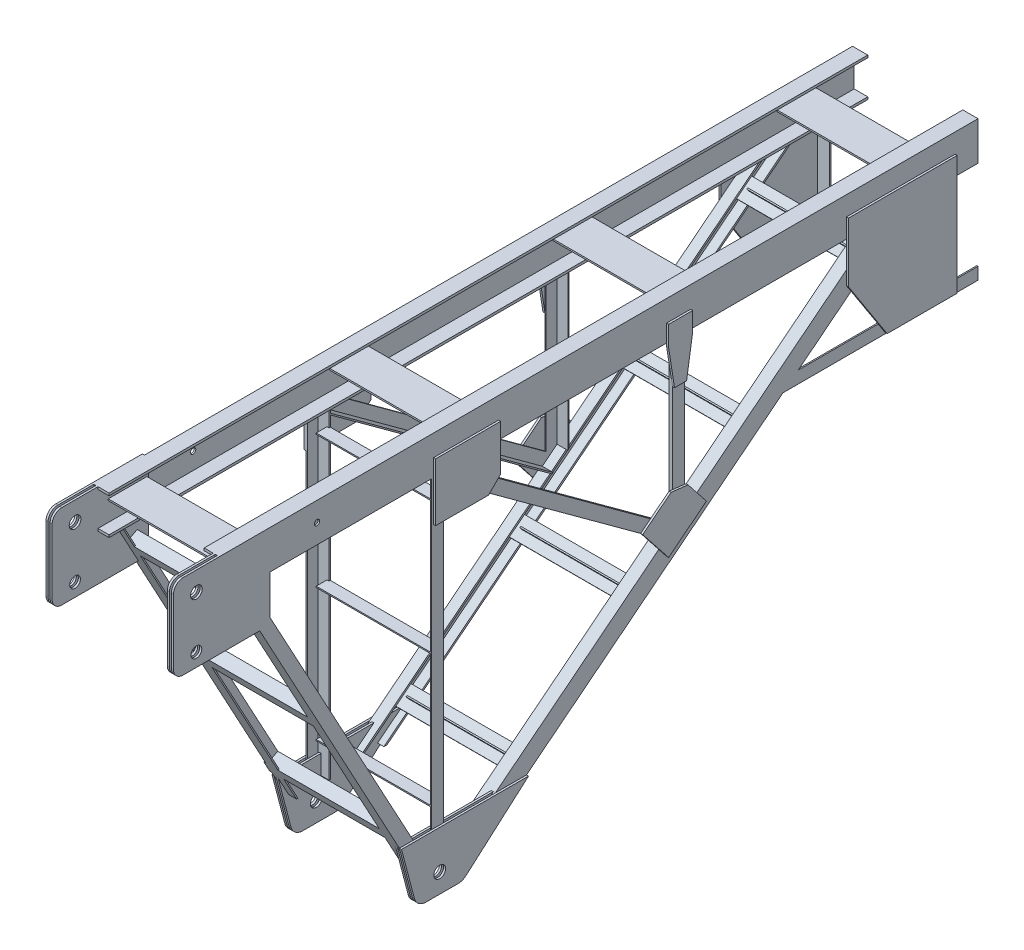
from build123d import *

# Parameters (mm, degrees)
EXTRUDE_1_DEPTH               = 3335
EXTRUDE_1_2_DEPTH             = 3335
EXTRUDE_3_DEPTH               = 511.5
SKETCH_11_R                   = 24.25
CUT_EXTRUDE_10_DEPTH          = 3380.086414994
PATTERN_LINEAR_1_COUNT        = 4
PATTERN_LINEAR_1_PITCH        = 927.5
EXTRUDE_11_DEPTH              = 50
PATTERN_LINEAR_2_COUNT        = 2
PATTERN_LINEAR_2_PITCH        = 470
CUT_EXTRUDE_12_DEPTH          = 45
CUT_EXTRUDE_13_DEPTH          = 7
CUT_EXTRUDE_14_DEPTH          = 38
CUT_EXTRUDE_15_DEPTH          = 45
CUT_EXTRUDE_16_DEPTH          = 2
CUT_EXTRUDE_17_DEPTH          = 42.7
SKETCH_21_W                   = 50
SKETCH_21_H                   = 50
EXTRUDE_18_DEPTH              = 478.5
PATTERN_LINEAR_3_COUNT        = 3
PATTERN_LINEAR_3_PITCH        = 550
SKETCH_25_W                   = 510
SKETCH_25_H                   = 45
CUT_EXTRUDE_19_DEPTH          = 45
EXTRUDE_20_DEPTH              = 528.5
PATTERN_LINEAR_4_COUNT        = 3
PATTERN_LINEAR_4_PITCH        = 625
SKETCH_27_W                   = 510
SKETCH_27_H                   = 45
CUT_EXTRUDE_21_DEPTH          = 45
EXTRUDE_22_DEPTH              = 520
SKETCH_30_W                   = 430
SKETCH_30_H                   = 5
EXTRUDE_23_DEPTH              = 15
PATTERN_LINEAR_5_COUNT        = 4
PATTERN_LINEAR_5_PITCH        = 600
EXTRUDE_24_DEPTH              = 8.5
PATTERN_LINEAR_6_COUNT        = 2
PATTERN_LINEAR_6_PITCH        = 17
PATTERN_LINEAR_7_COUNT        = 2
PATTERN_LINEAR_7_PITCH        = 511.5
PATTERN_LINEAR_7_COPY_1_DEPTH = 8.5
SKETCH_33_W                   = 8.5
SKETCH_33_H                   = 400
CUT_EXTRUDE_26_DEPTH          = 160
FILLET_1_R                    = 50
SKETCH_35_R                   = 24.25
CUT_EXTRUDE_27_DEPTH          = 3697.024080008
SKETCH_36_W                   = 486
SKETCH_36_H                   = 500
CUT_EXTRUDE_28_DEPTH          = 160
SKETCH_37_W                   = 503
SKETCH_37_H                   = 160
CUT_EXTRUDE_29_DEPTH          = 190
EXTRUDE_30_DEPTH              = 2
PATTERN_LINEAR_8_COUNT        = 2
PATTERN_LINEAR_8_PITCH        = 505
EXTRUDE_31_DEPTH              = 8.5
PATTERN_LINEAR_9_COUNT        = 2
PATTERN_LINEAR_9_PITCH        = 17
SKETCH_40_R                   = 24.25
CUT_EXTRUDE_32_DEPTH          = 3697.024080008
SKETCH_41_W                   = 8.5
SKETCH_41_H                   = 160
CUT_EXTRUDE_33_DEPTH          = 190
SKETCH_42_W                   = 100
SKETCH_42_H                   = 140
EXTRUDE_34_DEPTH              = 2
SKETCH_43_W                   = 142.5
SKETCH_43_H                   = 140
CUT_EXTRUDE_36_DEPTH          = 2
SKETCH_48_W                   = 50
SKETCH_48_H                   = 370
EXTRUDE_40_DEPTH              = 520
CUT_EXTRUDE_41_DEPTH          = 370
EXTRUDE_42_DEPTH              = 50
PATTERN_LINEAR_10_COUNT       = 2
PATTERN_LINEAR_10_PITCH       = 470
SKETCH_51_W                   = 140
SKETCH_51_H                   = 45
CUT_EXTRUDE_43_DEPTH          = 45
SKETCH_52_W                   = 140
SKETCH_52_H                   = 45
CUT_EXTRUDE_44_DEPTH          = 45
EXTRUDE_45_DEPTH              = 420
EXTRUDE_46_DEPTH              = 8.5
PATTERN_LINEAR_11_COUNT       = 2
PATTERN_LINEAR_11_PITCH       = 528.5
EXTRUDE_49_DEPTH              = 50
EXTRUDE_50_DEPTH              = 50
PATTERN_LINEAR_15_COUNT       = 2
PATTERN_LINEAR_15_PITCH       = 478.5
CUT_EXTRUDE_51_DEPTH          = 45
CUT_EXTRUDE_53_DEPTH          = 45
SKETCH_64_W                   = 269.026810319
SKETCH_64_H                   = 240
EXTRUDE_54_DEPTH              = 8.5
PATTERN_LINEAR_16_COUNT       = 2
PATTERN_LINEAR_16_PITCH       = 537
CHAMFER_1_SIZE                = 50
PATTERN_LINEAR_17_COUNT       = 2
PATTERN_LINEAR_17_PITCH       = 520
PATTERN_LINEAR_18_COUNT       = 2
PATTERN_LINEAR_18_PITCH       = 503
SKETCH_65_R                   = 24.25
SKETCH_65_R_2                 = 22.25
CUT_EXTRUDE_55_DEPTH          = 3695.798675165
FILLET_3_R                    = 40
SKETCH_66_R                   = 11
CUT_EXTRUDE_56_DEPTH          = 3695.798675165


with BuildPart() as part:
    # 草图2 → 拉伸1 (new body)
    with BuildSketch(Plane.XY):
        Polygon((0, 0), (0, 160), (63, 160), (63, 150), (6.5, 150), (6.5, 10), (63, 10), (63, 0), align=None)
    extrude(amount=EXTRUDE_1_DEPTH)

    # 草图5 → 拉伸3 (add)
    with BuildSketch(Plane.ZY):
        Polygon((160, 95), (320, 95), (320, 88.5), (243.25, 88.5), (243.25, 48.5), (236.75, 48.5), (236.75, 88.5), (160, 88.5), align=None)
    extrude_3 = extrude(amount=-EXTRUDE_3_DEPTH)


with BuildPart() as body_2:
    # 草图2 → Extrude 1 2 (new body)
    with BuildSketch(Plane.XY):
        Polygon((457, 160), (520, 160), (520, 0), (457, 0), (457, 10), (513.5, 10), (513.5, 150), (457, 150), align=None)
    extrude(amount=EXTRUDE_1_2_DEPTH)


with BuildPart() as cut_extrude_10_tool:
    # 草图11 → 拉伸10 (new, through all)
    with BuildSketch(Plane.ZY):
        with Locations((3240, 80)):
            Circle(SKETCH_11_R)
    extrude(amount=-CUT_EXTRUDE_10_DEPTH)


with BuildPart() as part_1:
    add(part.part)

    # 拉伸10: cut by cut_extrude_10_tool
    add(cut_extrude_10_tool.part, mode=Mode.SUBTRACT)

    # 阵列(线性)1: 拉伸3 ×4
    with Locations(*[(0, 0, i * PATTERN_LINEAR_1_PITCH) for i in range(1, PATTERN_LINEAR_1_COUNT)]):
        add(extrude_3)

    # 草图12 → 拉伸11 (add)
    with BuildSketch(Plane.ZY):
        Polygon((276.739148331, 0), (2175.473325546, -1500), (2268.42568906, -1500), (3080.134549819, 0), (3023.2831717, 0), (2265, -1401.271826065), (2265, 0), (2215, 0), (2215, -1429.273927181), (405.792497239, 0), align=None)
    extrude_11 = extrude(amount=-EXTRUDE_11_DEPTH)

    # 草图15 → 拉伸12 (cut)
    with BuildSketch(Plane(origin=(50, 0, 0), x_dir=(0, 0, -1), z_dir=(1, 0, 0))):
        Polygon((-2265, 0), (-2220, 0), (-2220, -1500), (-2262.740551248, -1500), (-3074.449412007, 0), (-3023.2831717, 0), (-2265, -1401.271826065), align=None)
    extrude(amount=-CUT_EXTRUDE_12_DEPTH, mode=Mode.SUBTRACT)

    # 草图16 → 拉伸13 (cut)
    with BuildSketch(Plane(origin=(50, 0, 0), x_dir=(0, 0, -1), z_dir=(1, 0, 0))):
        Polygon((-405.792497239, 0), (-276.739148331, 0), (-2175.473325546, -1500), (-2215, -1500), (-2215, -1429.273927181), align=None)
    extrude(amount=-CUT_EXTRUDE_13_DEPTH, mode=Mode.SUBTRACT)

    # 草图17 → 拉伸14 (cut)
    with BuildSketch(Plane(origin=(43, 0, 0), x_dir=(0, 0, -1), z_dir=(1, 0, 0))):
        Polygon((-2188.378660437, -1500), (-2215, -1500), (-2215, -1439.469141745), (-392.887162348, 0), (-289.644483222, 0), align=None)
    extrude(amount=-CUT_EXTRUDE_14_DEPTH, mode=Mode.SUBTRACT)


with BuildPart() as body_2_1:
    add(body_2.part)

    # 拉伸10: cut by cut_extrude_10_tool
    add(cut_extrude_10_tool.part, mode=Mode.SUBTRACT)

    # 阵列(线性)2: 拉伸11 ×2
    with Locations(*[(i * PATTERN_LINEAR_2_PITCH, 0, 0) for i in range(1, PATTERN_LINEAR_2_COUNT)]):
        add(extrude_11)

    # 草图18 → 拉伸15 (cut)
    with BuildSketch(Plane.ZY.offset(-470)):
        Polygon((3074.449412007, 0), (3023.2831717, 0), (2265, -1401.271826065), (2265, 0), (2220, 0), (2220, -1500), (2262.740551248, -1500), align=None)
    extrude(amount=-CUT_EXTRUDE_15_DEPTH, mode=Mode.SUBTRACT)

    # 草图19 → 拉伸16 (cut)
    with BuildSketch(Plane.ZY.offset(-470)):
        Polygon((289.644483222, 0), (392.887162348, 0), (2215, -1439.469141745), (2215, -1500), (2188.378660437, -1500), align=None)
    extrude(amount=-CUT_EXTRUDE_16_DEPTH, mode=Mode.SUBTRACT)

    # 草图20 → 拉伸17 (cut)
    with BuildSketch(Plane.ZY.offset(-472)):
        Polygon((290.451066652, 0), (392.080578917, 0), (2215, -1440.106342655), (2215, -1500), (2189.185243868, -1500), align=None)
    extrude(amount=-CUT_EXTRUDE_17_DEPTH, mode=Mode.SUBTRACT)

    # 草图21 → 拉伸18 (add)
    with BuildSketch(Plane(origin=(520, 0, 0), x_dir=(0, 0, -1), z_dir=(1, 0, 0))):
        with Locations((-2240, -100)):
            Rectangle(SKETCH_21_W, SKETCH_21_H)
    extrude_18 = extrude(amount=-EXTRUDE_18_DEPTH)


with BuildPart() as part_2:
    add(part_1.part)

    add(body_2_1.part)  # 阵列(线性)3 merges body 2
    # 阵列(线性)3: 拉伸18 ×3
    with Locations(*[(0, -i * PATTERN_LINEAR_3_PITCH, 0) for i in range(1, PATTERN_LINEAR_3_COUNT)]):
        add(extrude_18)

    # 草图25 → 拉伸19 (cut)
    with BuildSketch(Plane.XY.offset(2265)):
        with Locations((260, -102.5)):
            Rectangle(SKETCH_25_W, SKETCH_25_H)
        with Locations((260, -652.5)):
            Rectangle(SKETCH_25_W, SKETCH_25_H)
        with Locations((260, -1202.5)):
            Rectangle(SKETCH_25_W, SKETCH_25_H)
    extrude(amount=-CUT_EXTRUDE_19_DEPTH, mode=Mode.SUBTRACT)

    # 草图26 → 拉伸20 (add)
    with BuildSketch(Plane(origin=(520, 0, 0), x_dir=(0, 0, -1), z_dir=(1, 0, 0))):
        Polygon((-2982.697728662, -75), (-3026.672036457, -98.796223522), (-3002.875812935, -142.770531318), (-2958.90150514, -118.974307795), align=None)
    extrude_20 = extrude(amount=-EXTRUDE_20_DEPTH)

    # 阵列(线性)4: 拉伸20 ×3
    with Locations(*[Vector(0, -0.8794861559075047, -0.47592447044362035) * (i * PATTERN_LINEAR_4_PITCH) for i in range(1, PATTERN_LINEAR_4_COUNT)]):
        add(extrude_20)

    # 草图27 → 拉伸21 (cut)
    with BuildSketch(Plane(origin=(0, -1265.452562538, 2338.497133111), x_dir=(-1, 0, 0), z_dir=(0, 0.4759244704436186, -0.8794861559075056))):
        with Locations((-260, 1326.077375314)):
            Rectangle(SKETCH_27_W, SKETCH_27_H)
        with Locations((-260, 701.077375314)):
            Rectangle(SKETCH_27_W, SKETCH_27_H)
        with Locations((-260, 76.077375314)):
            Rectangle(SKETCH_27_W, SKETCH_27_H)
    extrude(amount=-CUT_EXTRUDE_21_DEPTH, mode=Mode.SUBTRACT)

    # 草图29 → 拉伸22 (add)
    with BuildSketch(Plane.ZY):
        Polygon((440.235448799, -75), (503.009998172, -124.591894005), (499.910504797, -128.515303341), (437.135955424, -78.923409336), align=None)
    extrude_22 = extrude(amount=-EXTRUDE_22_DEPTH)

    # 草图30 → 拉伸23 (add)
    with BuildSketch(Plane(origin=(0, 167.961335233, 132.689454834), x_dir=(1, 0, 0), z_dir=(0, 0.7846818671653424, 0.6198986750606201))):
        with Locations((259.85, -431.937174585)):
            Rectangle(SKETCH_30_W, SKETCH_30_H)
    extrude_23 = extrude(amount=EXTRUDE_23_DEPTH)

    # 阵列(线性)5: 拉伸22, 拉伸23 ×4
    with Locations(*[Vector(0, -0.6198986750606202, 0.7846818671653422) * (i * PATTERN_LINEAR_5_PITCH) for i in range(1, PATTERN_LINEAR_5_COUNT)]):
        add(extrude_22)
        add(extrude_23)

    # 草图31 → 拉伸24 (add)
    with BuildSketch(Plane(origin=(520, 0, 0), x_dir=(0, 0, -1), z_dir=(1, 0, 0))):
        Polygon((-2398.299106781, -1260), (-1871.675857192, -1260), (-2145, -1500), (-2335, -1500), align=None)
    extrude_24 = extrude(amount=EXTRUDE_24_DEPTH)

    # 阵列(线性)6: 拉伸24 ×2
    with Locations(*[(-i * PATTERN_LINEAR_6_PITCH, 0, 0) for i in range(1, PATTERN_LINEAR_6_COUNT)]):
        add(extrude_24)

    # 阵列(线性)7: 拉伸24 ×2
    with Locations(*[(-i * PATTERN_LINEAR_7_PITCH, 0, 0) for i in range(1, PATTERN_LINEAR_7_COUNT)]):
        add(extrude_24)

    # 阵列(线性)7 copy 1 sketch → 阵列(线性)7 copy 1 (add)
    with BuildSketch(Plane(origin=(-8.5, 0, 0), x_dir=(0, 0, -1), z_dir=(1, 0, 0))):
        Polygon((-2398.299106781, -1260), (-1871.675857192, -1260), (-2145, -1500), (-2335, -1500), align=None)
    extrude(amount=PATTERN_LINEAR_7_COPY_1_DEPTH)

    # 草图33 → 拉伸26 (cut)
    with BuildSketch(Plane.XZ.offset(1500)):
        with Locations((515.75, 2241.370275624)):
            Rectangle(SKETCH_33_W, SKETCH_33_H)
        with Locations((4.25, 2241.370275624)):
            Rectangle(SKETCH_33_W, SKETCH_33_H)
    extrude(amount=-CUT_EXTRUDE_26_DEPTH, mode=Mode.SUBTRACT)

    # 圆角1
    fillet_1_edges = [part_2.edges().sort_by_distance(p)[0] for p in [
        (524.25, -1500, 2335),
        (524.25, -1500, 2145),
        (507.25, -1500, 2335),
        (507.25, -1500, 2145),
        (12.75, -1500, 2335),
        (12.75, -1500, 2145),
        (-4.25, -1500, 2335),
        (-4.25, -1500, 2145),
    ]]
    fillet(fillet_1_edges, radius=FILLET_1_R)

    # 草图35 → 拉伸27 (cut, through all)
    with BuildSketch(Plane.ZY.offset(8.5)):
        with Locations((2240, -1420)):
            Circle(SKETCH_35_R)
    extrude(amount=-CUT_EXTRUDE_27_DEPTH, mode=Mode.SUBTRACT)

    # 草图36 → 拉伸28 (cut)
    with BuildSketch(Plane.XZ.offset(1500)):
        with Locations((260, 2222.740551248)):
            Rectangle(SKETCH_36_W, SKETCH_36_H)
    extrude(amount=-CUT_EXTRUDE_28_DEPTH, mode=Mode.SUBTRACT)

    # 草图37 → 拉伸29 (cut)
    with BuildSketch(Plane.XY.offset(3335)):
        with Locations((260, 80)):
            Rectangle(SKETCH_37_W, SKETCH_37_H)
    extrude(amount=-CUT_EXTRUDE_29_DEPTH, mode=Mode.SUBTRACT)

    # 草图38 → 拉伸30 (add)
    with BuildSketch(Plane(origin=(6.5, 0, 0), x_dir=(0, 0, -1), z_dir=(1, 0, 0))):
        Polygon((-3335, 150), (-2862.5, 150), (-2792.5, 80), (-2862.5, 10), (-3335, 10), align=None)
    extrude_30 = extrude(amount=EXTRUDE_30_DEPTH)

    # 阵列(线性)8: 拉伸30 ×2
    with Locations(*[(i * PATTERN_LINEAR_8_PITCH, 0, 0) for i in range(1, PATTERN_LINEAR_8_COUNT)]):
        add(extrude_30)

    # 草图39 → 拉伸31 (add)
    with BuildSketch(Plane.ZY):
        Polygon((3335, 160), (2935, 160), (2935, -163.143171095), (2977.318094123, -190), (3335, -190), align=None)
    extrude_31 = extrude(amount=EXTRUDE_31_DEPTH)

    # 阵列(线性)9: 拉伸31 ×2
    with Locations(*[(i * PATTERN_LINEAR_9_PITCH, 0, 0) for i in range(1, PATTERN_LINEAR_9_COUNT)]):
        add(extrude_31)

    # 草图40 → 拉伸32 (cut, through all)
    with BuildSketch(Plane.ZY.offset(8.5)):
        with Locations((3240, 80)):
            Circle(SKETCH_40_R)
    extrude(amount=-CUT_EXTRUDE_32_DEPTH, mode=Mode.SUBTRACT)

    # 草图41 → 拉伸33 (cut)
    with BuildSketch(Plane.XY.offset(3335)):
        with Locations((4.25, 80)):
            Rectangle(SKETCH_41_W, SKETCH_41_H)
    extrude(amount=-CUT_EXTRUDE_33_DEPTH, mode=Mode.SUBTRACT)

    # 草图42 → 拉伸34 (add)
    with BuildSketch(Plane(origin=(6.5, 0, 0), x_dir=(0, 0, -1), z_dir=(1, 0, 0))):
        with Locations((-2985, 80)):
            Rectangle(SKETCH_42_W, SKETCH_42_H)
    extrude(amount=EXTRUDE_34_DEPTH)

    # 草图43 → 拉伸36 (cut)
    with BuildSketch(Plane(origin=(6.5, 0, 0), x_dir=(0, 0, -1), z_dir=(1, 0, 0))):
        with Locations((-2863.75, 80)):
            Rectangle(SKETCH_43_W, SKETCH_43_H)
    extrude(amount=CUT_EXTRUDE_36_DEPTH, mode=Mode.SUBTRACT)



with BuildPart() as body_2_2:
    # 草图48 → 拉伸40 (new body)
    with BuildSketch(Plane.ZY):
        with Locations((120, -185)):
            Rectangle(SKETCH_48_W, SKETCH_48_H)
    extrude(amount=-EXTRUDE_40_DEPTH)

    # 草图49 → 拉伸41 (cut)
    with BuildSketch(Plane.XZ.offset(370)):
        Polygon((5, 95), (5, 140), (50, 140), (50, 145), (470, 145), (470, 140), (515, 140), (515, 95), align=None)
    extrude(amount=-CUT_EXTRUDE_41_DEPTH, mode=Mode.SUBTRACT)


with BuildPart() as cut_extrude_41_piece_1:
    # of the separate pieces the step leaves, piece 1, a body of its own (cut_extrude_41_pieces)
    add(body_2_2.part.solids().sort_by_distance((515, 0, 140))[0])


with BuildPart() as cut_extrude_41_piece_2:
    # of the separate pieces the step leaves, piece 2, a body of its own (cut_extrude_41_pieces)
    add(body_2_2.part.solids().sort_by_distance((0, 0, 95))[0])


with BuildPart() as part_3:
    add(part_2.part)

    add(cut_extrude_41_piece_2.part)  # 拉伸42 merges 拉伸41 piece 2
    # 草图50 → 拉伸42 (add)
    with BuildSketch(Plane.ZY):
        Polygon((0, -370), (745.093578711, -370), (808.384717951, -420), (0, -420), align=None)
    extrude_42 = extrude(amount=-EXTRUDE_42_DEPTH)


    add(cut_extrude_41_piece_1.part)  # 阵列(线性)10 merges 拉伸41 piece 1
    # 阵列(线性)10: 拉伸42 ×2
    with Locations(*[(i * PATTERN_LINEAR_10_PITCH, 0, 0) for i in range(1, PATTERN_LINEAR_10_COUNT)]):
        add(extrude_42)

    # 草图51 → 拉伸43 (cut)
    with BuildSketch(Plane(origin=(50, 0, 0), x_dir=(0, 0, -1), z_dir=(1, 0, 0))):
        with Locations((-70, -392.5)):
            Rectangle(SKETCH_51_W, SKETCH_51_H)
        Polygon((-802.055604027, -415), (-745.093578711, -370), (-145, -370), (-145, -415), align=None)
    extrude(amount=-CUT_EXTRUDE_43_DEPTH, mode=Mode.SUBTRACT)

    # 草图52 → 拉伸44 (cut)
    with BuildSketch(Plane.ZY.offset(-470)):
        with Locations((70, -392.5)):
            Rectangle(SKETCH_52_W, SKETCH_52_H)
        Polygon((145, -370), (145, -415), (802.055604027, -415), (745.093578711, -370), align=None)
    extrude(amount=-CUT_EXTRUDE_44_DEPTH, mode=Mode.SUBTRACT)

    # 草图53 → 拉伸45 (add)
    with BuildSketch(Plane(origin=(50, 0, 0), x_dir=(0, 0, -1), z_dir=(1, 0, 0))):
        Polygon((-145, -370), (-145, -420), (-95, -420), (-95, -415), (-140, -415), (-140, -370), align=None)
    extrude(amount=EXTRUDE_45_DEPTH)

    # 草图55 → 拉伸46 (add)
    with BuildSketch(Plane.ZY):
        Polygon((95, 80), (95, -415), (385, -415), (545, -167.5), (545, 80), align=None)
    extrude_46 = extrude(amount=EXTRUDE_46_DEPTH)

    # 阵列(线性)11: 拉伸46 ×2
    with Locations(*[(i * PATTERN_LINEAR_11_PITCH, 0, 0) for i in range(1, PATTERN_LINEAR_11_COUNT)]):
        add(extrude_46)

    # 草图59 → 拉伸49 (add)
    with BuildSketch(Plane.ZY):
        Polygon((1225, 0), (1275, 0), (1275, -686.673927181), (1225, -647.173927181), align=None)
    extrude_49 = extrude(amount=-EXTRUDE_49_DEPTH)

    # 草图60 → 拉伸50 (add)
    with BuildSketch(Plane.ZY):
        Polygon((1275, -655.713909075), (2172.618287417, 0), (2215, 0), (2215, -30.960018107), (1295.361679078, -702.759653653), (1275, -686.673927181), align=None)
    extrude_50 = extrude(amount=-EXTRUDE_50_DEPTH)

    # 阵列(线性)15: 拉伸49, 拉伸50 ×2
    with Locations(*[(i * PATTERN_LINEAR_15_PITCH, 0, 0) for i in range(1, PATTERN_LINEAR_15_COUNT)]):
        add(extrude_49)
        add(extrude_50)

    # 草图61 → 拉伸51 (cut)
    with BuildSketch(Plane(origin=(50, 0, 0), x_dir=(0, 0, -1), z_dir=(1, 0, 0))):
        Polygon((-2172.618287417, 0), (-2215, 0), (-2215, -24.768014485), (-1291.289343263, -699.542508359), (-1230, -651.123927181), (-1230, 0), (-1275, 0), (-1275, -655.713909075), align=None)
    extrude(amount=-CUT_EXTRUDE_51_DEPTH, mode=Mode.SUBTRACT)

    # 草图63 → 拉伸53 (cut)
    with BuildSketch(Plane.ZY.offset(-470)):
        Polygon((2172.618287417, 0), (2215, 0), (2215, -24.768014485), (1291.289343263, -699.542508359), (1230, -651.123927181), (1230, 0), (1275, 0), (1275, -655.713909075), align=None)
    extrude(amount=-CUT_EXTRUDE_53_DEPTH, mode=Mode.SUBTRACT)

    # 草图64 → 拉伸54 (add)
    with BuildSketch(Plane.ZY):
        Polygon((1200, 80), (1300, 80), (1300, 0), (1275, -160), (1225, -160), (1200, 0), align=None)
        with Locations((2130.48659484, -40)):
            Rectangle(SKETCH_64_W, SKETCH_64_H)
        Polygon((1142.682451349, -633.119136565), (1299.618824782, -757.098871577), (1406.936373433, -621.253873285), (1250, -497.274138272), align=None)
    extrude_54 = extrude(amount=EXTRUDE_54_DEPTH)

    # 阵列(线性)16: 拉伸54 ×2
    with Locations(*[(i * PATTERN_LINEAR_16_PITCH, 0, 0) for i in range(1, PATTERN_LINEAR_16_COUNT)]):
        add(extrude_54)

    # 倒角1
    # the kernel refuses this chamfer: 50 mm, written as the material it takes off along each edge
    with BuildSketch(Plane(origin=(0, -160, 1995.973189681), x_dir=(0, -0.027495876610586587, 0.9996219169112966), z_dir=(-1, 0, 0)), Plane(origin=(665.584149398, -497.274138272, 1250), x_dir=(0, -0.7673405347408222, -0.6412398176530127), z_dir=(-1, 0, 0))) as chamfer_1_piece_1:
        Polygon((CHAMFER_1_SIZE * 0.999621916911, CHAMFER_1_SIZE * 0.0274958766106), (-CHAMFER_1_SIZE * 0.0274958766106, CHAMFER_1_SIZE * 0.999621916911), (0, 0), align=None)
    extrude(amount=137.084149398, mode=Mode.SUBTRACT)
    with BuildSketch(Plane(origin=(0, -497.274138272, 1250), x_dir=(0, -0.598088786056726, 0.8014298497018886), z_dir=(-1, 0, 0)), Plane(origin=(665.584149398, -160, 1995.973189681), x_dir=(0, 0.9996219169112966, -0.027495876610586594), z_dir=(-1, 0, 0))) as chamfer_1_piece_2:
        Polygon((CHAMFER_1_SIZE * 0.999621916911, -CHAMFER_1_SIZE * 0.0274958766106), (-CHAMFER_1_SIZE * 0.0274958766106, -CHAMFER_1_SIZE * 0.999621916911), (0, 0), align=None)
    extrude(amount=137.084149398, mode=Mode.SUBTRACT)

    # 阵列(线性)17: 拉伸31 ×2
    with Locations(*[(i * PATTERN_LINEAR_17_PITCH, 0, 0) for i in range(1, PATTERN_LINEAR_17_COUNT)]):
        add(extrude_31)

    # 阵列(线性)18: 拉伸31 ×2
    with Locations(*[(i * PATTERN_LINEAR_18_PITCH, 0, 0) for i in range(1, PATTERN_LINEAR_18_COUNT)]):
        add(extrude_31)

    # 草图65 → 拉伸55 (cut, through all)
    with BuildSketch(Plane(origin=(520, 0, 0), x_dir=(0, 0, -1), z_dir=(1, 0, 0))):
        with Locations((-3240, 80)):
            Circle(SKETCH_65_R)
        with Locations((-3240, -135)):
            Circle(SKETCH_65_R_2)
    extrude(amount=-CUT_EXTRUDE_55_DEPTH, mode=Mode.SUBTRACT)

    # 圆角3
    fillet_3_edges = [part_3.edges().sort_by_distance(p)[0] for p in [
        (498.75, -190, 3335),
        (498.75, 160, 3335),
        (515.75, 160, 3335),
        (12.75, 160, 3335),
        (12.75, -190, 3335),
        (-4.25, 160, 3335),
        (-4.25, -190, 3335),
        (515.75, -190, 3335),
    ]]
    fillet(fillet_3_edges, radius=FILLET_3_R)

    # 草图66 → 拉伸56 (cut, through all)
    with BuildSketch(Plane(origin=(520, 0, 0), x_dir=(0, 0, -1), z_dir=(1, 0, 0))):
        with Locations((-2740, 80)):
            Circle(SKETCH_66_R)
    extrude(amount=-CUT_EXTRUDE_56_DEPTH, mode=Mode.SUBTRACT)


solid = part_3.part
